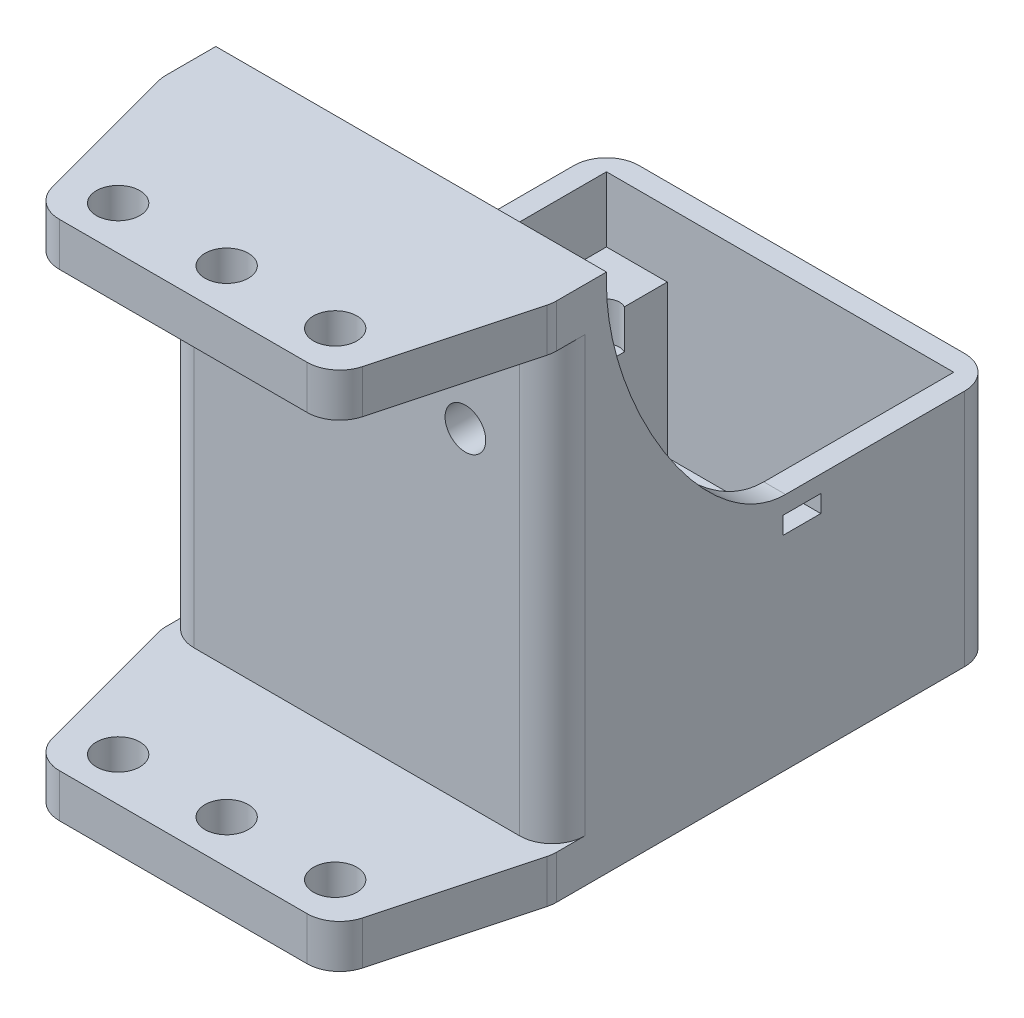
from build123d import *

# Parameters (mm, degrees)
SKETCH1_W           = 40.64
SKETCH1_H           = 40.64
BOSS_EXTRUDE1_DEPTH = 25.4
SHELL1_T            = 2.54
SKETCH2_W           = 7.112
SKETCH2_H           = 7.112
BOSS_EXTRUDE2_DEPTH = 17.78
BOSS_EXTRUDE3_DEPTH = 60.96
SKETCH5_W           = 20.32
SKETCH5_H           = 50.8
CUT_EXTRUDE1_DEPTH  = 90.198854813
SKETCH6_R           = 2.54
CUT_EXTRUDE2_DEPTH  = 82.804169209
FILLET1_R           = 3.81
SKETCH10_R          = 1.524
CUT_EXTRUDE4_DEPTH  = 4.572
CIRPATTERN1_COUNT   = 4
SKETCH11_R          = 7.3025
CUT_EXTRUDE5_DEPTH  = 80.929324406
RIB1_START          = -2.54
RIB1_DEPTH          = 2.54
SKETCH19_R          = 2.38125
CUT_EXTRUDE6_DEPTH  = 78.625990598
SKETCH20_W          = 2.032
SKETCH20_H          = 4.445


with BuildPart() as part:
    # Sketch1 → Boss-Extrude1 (new body)
    with BuildSketch(Plane(origin=(0, 0, 0), x_dir=(1, 0, 0), z_dir=(0, 1, 0))):
        Rectangle(SKETCH1_W, SKETCH1_H)
    extrude(amount=BOSS_EXTRUDE1_DEPTH)

    # Shell1
    shell1_openings = [part.faces().sort_by_distance(p)[0] for p in [
        (0, 25.4, 0),
    ]]
    offset(amount=SHELL1_T, openings=shell1_openings, kind=Kind.INTERSECTION)

    # Sketch2 → Boss-Extrude2 (add)
    with BuildSketch(Plane(origin=(0, 0, 0), x_dir=(1, 0, 0), z_dir=(0, 1, 0))):
        with Locations((-16.764, 16.764)):
            Rectangle(SKETCH2_W, SKETCH2_H)
    boss_extrude2 = extrude(amount=BOSS_EXTRUDE2_DEPTH)

    # Sketch3 → Boss-Extrude3 (add)
    with BuildSketch(Plane.XZ.offset(2.54)):
        with BuildLine():
            Line((-22.730177398, 29.694504546), (-17.41527241, 49.53))
            Line((-17.41527241, 49.53), (17.41527241, 49.53))
            Line((17.41527241, 49.53), (22.730177398, 29.694504546))
            ThreePointArc((22.730177398, 29.694504546), (22.827404922, 29.205708777), (22.86, 28.708403984))
            Line((22.86, 28.708403984), (22.86, 22.86))
            Line((22.86, 22.86), (-22.86, 22.86))
            Line((-22.86, 22.86), (-22.86, 28.708403984))
            ThreePointArc((-22.86, 28.708403984), (-22.827404922, 29.205708777), (-22.730177398, 29.694504546))
        make_face()
    extrude(amount=-BOSS_EXTRUDE3_DEPTH)

    # Sketch5 → Cut-Extrude1 (cut, through all)
    with BuildSketch(Plane.ZY.offset(22.86)):
        with Locations((39.37, 27.94)):
            Rectangle(SKETCH5_W, SKETCH5_H)
    extrude(amount=-CUT_EXTRUDE1_DEPTH, mode=Mode.SUBTRACT)

    # Sketch6 → Cut-Extrude2 (cut, through all)
    with BuildSketch(Plane(origin=(0, 58.42, 0), x_dir=(1, 0, 0), z_dir=(0, 1, 0))):
        with Locations(Location((-12.7, -44.45, 0), (0, 0, 270))):
            Circle(SKETCH6_R)
        with Locations(Location((0, -44.45, 0), (0, 0, 270))):
            Circle(SKETCH6_R)
        with Locations(Location((12.7, -44.45, 0), (0, 0, 270))):
            Circle(SKETCH6_R)
    extrude(amount=-CUT_EXTRUDE2_DEPTH, mode=Mode.SUBTRACT)

    # Fillet1
    # the kernel refuses this fillet: 3.81 mm, written as the material it takes off along each edge
    with BuildSketch(Plane(origin=(-17.41527241, 46.03121044, 49.53), x_dir=(-0.25881904510252424, 0, -0.9659258262890673), z_dir=(0, 1, 0)), Plane(origin=(17.41527241, 46.03121044, 49.53), x_dir=(-1, 0, 0), z_dir=(0, 1, 0)), Plane(origin=(-17.41527241, -9.84878956, 49.53), x_dir=(-0.25881904510252424, 0, -0.9659258262890673), z_dir=(0, 1, 0)), Plane(origin=(17.41527241, -9.84878956, 49.53), x_dir=(-1, 0, 0), z_dir=(0, 1, 0))) as fillet1_piece_1:
        with BuildLine():
            CenterArc((FILLET1_R * 0.767326987979, -FILLET1_R), FILLET1_R, 90, 75)
            Line((-FILLET1_R * 0.19859883831, -FILLET1_R * 0.741180954897), (0, 0))
            Line((0, 0), (FILLET1_R * 0.767326987979, 0))
        make_face()
    extrude(amount=19.697579121, mode=Mode.SUBTRACT)
    with BuildSketch(Plane(origin=(-22.826837491, 53.34, 29.21), x_dir=(-0.008703740786851863, 0, -0.999962121730776), z_dir=(0, -1, 0))) as fillet1_piece_2:
        with BuildLine():
            CenterArc((3.776983069, 3.809855684), FILLET1_R, 180.49869391, 90)
            Line((-0.032872615, 3.776694431), (-0.413858183, 3.773378306))
            Line((-0.413858183, 3.773378306), (-0.380985568, -0.003316125))
            Line((-0.380985568, -0.003316125), (-0.04687044, -0.378106019))
            ThreePointArc((-0.04687044, -0.378106019), (0.505181779, -0.409781059), (3.813460447, -0.380985568))
            Line((3.813460447, -0.380985568), (3.810144322, 0))
        make_face()
    extrude(amount=50.8, mode=Mode.SUBTRACT)
    with BuildSketch(Plane(origin=(22.826837491, 53.34, 29.21), x_dir=(0.008703740786853719, 0, -0.999962121730776), z_dir=(0, -1, 0))) as fillet1_piece_3:
        with BuildLine():
            CenterArc((3.776983069, -3.809855684), FILLET1_R, 89.50130609, 90)
            Line((-0.032872615, -3.776694431), (-0.413858183, -3.773378306))
            Line((-0.413858183, -3.773378306), (-0.380985568, 0.003316125))
            Line((-0.380985568, 0.003316125), (-0.04687044, 0.378106019))
            ThreePointArc((-0.04687044, 0.378106019), (0.505181779, 0.409781059), (3.813460447, 0.380985568))
            Line((3.813460447, 0.380985568), (3.810144322, 0))
        make_face()
    extrude(amount=50.8, mode=Mode.SUBTRACT)
    with BuildSketch(Plane(origin=(-22.86, -12.065, -22.86), x_dir=(1, 0, 0), z_dir=(0, 1, 0))) as fillet1_piece_4:
        with BuildLine():
            CenterArc((FILLET1_R, -FILLET1_R), FILLET1_R, 90, 90)
            Line((0, -FILLET1_R), (0, 0))
            Line((0, 0), (FILLET1_R, 0))
        make_face()
    extrude(amount=46.99, mode=Mode.SUBTRACT)
    with BuildSketch(Plane(origin=(22.86, -12.065, -22.86), x_dir=(-1, 0, 0), z_dir=(0, 1, 0))) as fillet1_piece_5:
        with BuildLine():
            CenterArc((FILLET1_R, FILLET1_R), FILLET1_R, 180, 90)
            Line((0, FILLET1_R), (0, 0))
            Line((0, 0), (FILLET1_R, 0))
        make_face()
    extrude(amount=46.99, mode=Mode.SUBTRACT)

    # Sketch10 → Cut-Extrude4 (cut)
    with BuildSketch(Plane.XZ.offset(-13.208)):
        with Locations((-13.97, -13.97)):
            Circle(SKETCH10_R)
    cut_extrude4 = extrude(amount=-CUT_EXTRUDE4_DEPTH, mode=Mode.SUBTRACT)

    # CirPattern1: Boss-Extrude2, Cut-Extrude4 ×4 about axis
    cirpattern1_axis = Axis((0, 0, 0), (0, 1, 0))
    add([boss_extrude2.rotate(cirpattern1_axis, i * 360 / CIRPATTERN1_COUNT) for i in range(1, CIRPATTERN1_COUNT)])
    add([cut_extrude4.rotate(cirpattern1_axis, i * 360 / CIRPATTERN1_COUNT) for i in range(1, CIRPATTERN1_COUNT)], mode=Mode.SUBTRACT)

    # Sketch11 → Cut-Extrude5 (cut, through all)
    with BuildSketch(Plane(origin=(0, 0, 0), x_dir=(1, 0, 0), z_dir=(0, 1, 0))):
        with Locations(Location((0, 0, 0), (0, 0, 270))):
            Circle(SKETCH11_R)
    extrude(amount=-CUT_EXTRUDE5_DEPTH, mode=Mode.SUBTRACT)

    # Sketch12 → Revolve1 (revolve)
    with BuildSketch(Plane.XY, mode=Mode.PRIVATE) as revolve1_sk:
        Polygon((-11.1125, -2.54), (-11.1125, -5.08), (-7.3025, -2.54), align=None)
    revolve(revolve1_sk.sketch.rotate(Axis((0, 12.66825, 0), (0, -1, 0)), 270), axis=Axis((0, 12.66825, 0), (0, -1, 0)))

    # Rib1: read off the stored shape, not the designer's step
    # Rib1 outline → Rib1 (add)
    with BuildSketch(Plane.ZY.offset(22.86).offset(RIB1_START)):
        with BuildLine():
            add(Edge.make_bspline(
                [(1.905, 25.4), (11.363397975, 25.4), (22.86, 44.45), (22.86, 57.15)],
                knots=[0, 0, 0, 0, 1, 1, 1, 1], degree=3))
            Line((1.905, 25.4), (22.86, 25.4))
            Line((22.86, 25.4), (22.86, 57.15))
        make_face()
    rib1 = extrude(amount=RIB1_DEPTH)

    # Mirror2: Rib1 across plane
    add(rib1.mirror(Plane(origin=(0, 0, 0), x_dir=(0, 0, 1), z_dir=(1, 0, 0))))

    # Sketch19 → Cut-Extrude6 (cut, through all)
    with BuildSketch(Plane(origin=(0, 0, 22.86), x_dir=(-1, 0, 0), z_dir=(0, 0, -1))):
        with Locations((-12.7, 40.64)):
            Circle(SKETCH19_R)
        with Locations((12.7, 40.64)):
            Circle(SKETCH19_R)
        with Locations((0, 40.64)):
            Circle(SKETCH19_R)
    extrude(amount=-CUT_EXTRUDE6_DEPTH, mode=Mode.SUBTRACT)

    # Cut-Sweep1: sweep along a path in Sketch21
    with BuildLine() as cut_sweep1_path:  # in the path sketch's own coordinates; laid on its plane below (add() does not lay a ready-made edge on the line's plane)
        Line((-22.86, 22.4155), (-19.05, 22.4155))
        add(Edge.make_bspline(
            [(-19.05, 22.4155), (-16.933333333, 22.4155), (-15.24, 23.791333333), (-15.24, 25.273)],
            knots=[0, 0, 0, 0, 1, 1, 1, 1], degree=3))
    # Sketch20 → Cut-Sweep1 (sweep, cut)
    with BuildSketch(Plane(origin=(0, 25.273, 0), x_dir=(1, 0, 0), z_dir=(0, 1, 0))):
        with Locations((-15.24, 0)):
            Rectangle(SKETCH20_W, SKETCH20_H)
    cut_sweep1 = sweep(path=Plane.XY * cut_sweep1_path.line, mode=Mode.SUBTRACT)

    # Mirror4: Cut-Sweep1 across plane
    add(cut_sweep1.mirror(Plane(origin=(0, 0, 0), x_dir=(0, 0, 1), z_dir=(1, 0, 0))), mode=Mode.SUBTRACT)


solid = part.part
